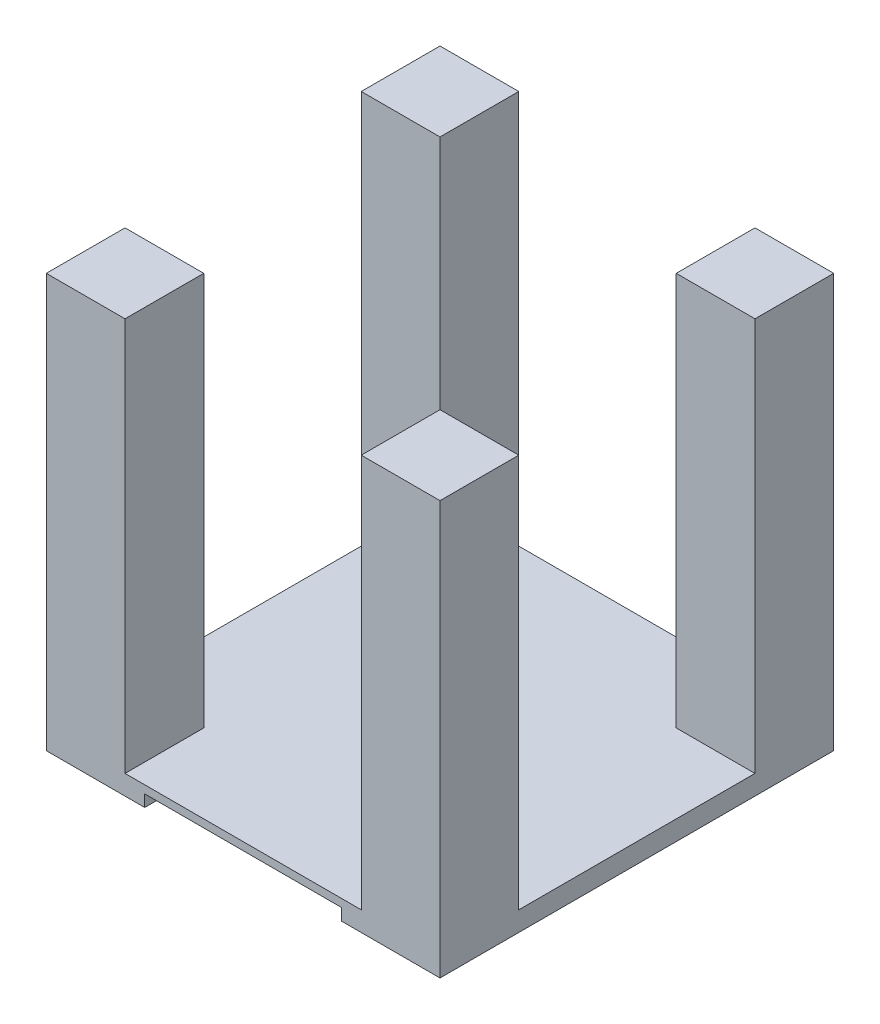
from build123d import *

# Parameters (mm, degrees)
SKETCH1_W                                  = 1000
SKETCH1_H                                  = 1000
BOSS_EXTRUDE1_DEPTH                        = 50
SKETCH2_W                                  = 200
SKETCH2_H                                  = 200
BOSS_EXTRUDE2_DEPTH                        = 1000
MIRROR2_AT_THE_SECOND_PLANE_COPY_1_SKETC_W = 200
MIRROR2_AT_THE_SECOND_PLANE_COPY_1_SKETC_H = 200
MIRROR2_AT_THE_SECOND_PLANE_COPY_1_DEPTH   = 1000
SKETCH4_W                                  = 500
SKETCH4_H                                  = 500
CUT_EXTRUDE1_DEPTH                         = 30


with BuildPart() as part:
    # Sketch1 → Boss-Extrude1 (new body)
    with BuildSketch(Plane(origin=(0, 0, 0), x_dir=(1, 0, 0), z_dir=(0, 1, 0))):
        Rectangle(SKETCH1_W, SKETCH1_H)
    extrude(amount=BOSS_EXTRUDE1_DEPTH)

    # Sketch2 → Boss-Extrude2 (add)
    with BuildSketch(Plane(origin=(0, 50, 0), x_dir=(1, 0, 0), z_dir=(0, 1, 0))):
        with Locations((-400, 400)):
            Rectangle(SKETCH2_W, SKETCH2_H)
    boss_extrude2 = extrude(amount=BOSS_EXTRUDE2_DEPTH)

    # Mirror1: Boss-Extrude2 across plane
    add(boss_extrude2.mirror(Plane.XY))

    # Mirror2: Boss-Extrude2 across plane
    add(boss_extrude2.mirror(Plane.XY))

    # Mirror2 at the second plane: Boss-Extrude2 across plane
    add(boss_extrude2.mirror(Plane(origin=(0, 0, 0), x_dir=(0, 0, 1), z_dir=(1, 0, 0))))

    # Mirror2 at the second plane copy 1 sketc → Mirror2 at the second plane copy 1 (add)
    with BuildSketch(Plane(origin=(0, 50, 0), x_dir=(-1, 0, 0), z_dir=(0, 1, 0))):
        with Locations((-400, 400)):
            Rectangle(MIRROR2_AT_THE_SECOND_PLANE_COPY_1_SKETC_W, MIRROR2_AT_THE_SECOND_PLANE_COPY_1_SKETC_H)
    extrude(amount=MIRROR2_AT_THE_SECOND_PLANE_COPY_1_DEPTH)

    # Sketch4 → Cut-Extrude1 (cut)
    with BuildSketch(Plane.XZ):
        with Locations((0, 250)):
            Rectangle(SKETCH4_W, SKETCH4_H)
    extrude(amount=-CUT_EXTRUDE1_DEPTH, mode=Mode.SUBTRACT)


solid = part.part
